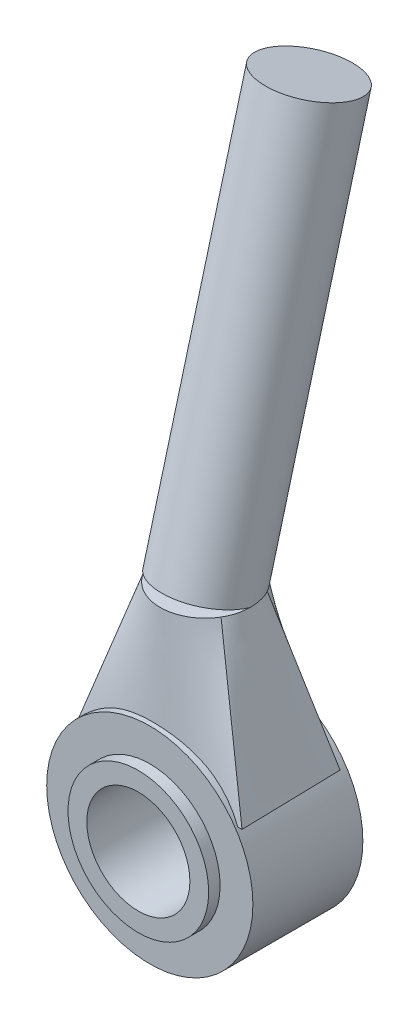
from build123d import *

# Parameters (mm, degrees)
SKETCH1_R               = 18
BOSS_EXTRUDE1_DEPTH     = 19.2
SKETCH2_R               = 12.276458432
SKETCH2_R_2             = 8.347690183
BOSS_EXTRUDE2_DEPTH     = 2
SKETCH3_R               = 8.347690183
BOSS_EXTRUDE4_DEPTH     = 6.8
FILLET1_R               = 4
SKETCH13_R              = 9
CUT_EXTRUDE4_DEPTH      = 50
BOSS_EXTRUDE6_START     = 31.338130328
BOSS_EXTRUDE6_OUTLINE_R = 7.85
BOSS_EXTRUDE6_DEPTH     = 69.999999999


with BuildPart() as part:
    # Sketch1 → Boss-Extrude1 (new body)
    with BuildSketch(Plane.XY):
        Circle(SKETCH1_R)
    extrude(amount=BOSS_EXTRUDE1_DEPTH)

    # Sketch2 → Boss-Extrude2 (add)
    with BuildSketch(Plane.XY.offset(19.2)):
        Circle(SKETCH2_R)
        Circle(SKETCH2_R_2, mode=Mode.SUBTRACT)
    extrude(amount=BOSS_EXTRUDE2_DEPTH)

    # Sketch3 → Boss-Extrude4 (add)
    with BuildSketch(Plane.XY.offset(19.2)):
        Circle(SKETCH3_R)
    extrude(amount=BOSS_EXTRUDE4_DEPTH)

    # Fillet1
    fillet1_edges = [part.edges().sort_by_distance(p)[0] for p in [
        (-8.347690183, 0, 26),
    ]]
    fillet(fillet1_edges, radius=FILLET1_R)

    # Loft5: read off the stored shape, not the designer's step
    # Loft5: loft between two sections, ruled curve by curve
    loft5_from = [
        Edge.make_bspline([(-13.870540046, 10, 1.272084055), (-13.870540046, 10, 2.733260237), (-13.870540046, 10, 4.19443642), (-13.870540046, 10, 7.116788785), (-13.870540046, 10, 8.577964967), (-13.870540046, 10, 11.500317332), (-13.870540046, 10, 12.961493515), (-13.870540046, 10, 15.88384588), (-13.870540046, 10, 17.345022062), (-13.870540046, 10, 18.806198245)], [0, 0, 0, 0, 0.25, 0.25, 0.5, 0.5, 0.75, 0.75, 1, 1, 1, 1], 3),
        Edge.make_bspline([(-13.870540046, 10, 18.806198245), (-12.638187033, 10, 18.806198245), (-11.40583402, 10, 18.806198245), (-8.941127993, 10, 18.806198245), (-7.70877498, 10, 18.806198245), (-5.244068953, 10, 18.806198245), (-4.01171594, 10, 18.806198245), (-1.547009913, 10, 18.806198245), (-0.3146569, 10, 18.806198245), (2.150049127, 10, 18.806198245), (3.38240214, 10, 18.806198245), (5.847108167, 10, 18.806198245), (7.07946118, 10, 18.806198245), (9.544167207, 10, 18.806198245), (10.77652022, 10, 18.806198245), (13.241226247, 10, 18.806198245), (14.47357926, 10, 18.806198245), (15.705932273, 10, 18.806198245)], [0, 0, 0, 0, 0.125, 0.125, 0.25, 0.25, 0.375, 0.375, 0.5, 0.5, 0.625, 0.625, 0.75, 0.75, 0.875, 0.875, 1, 1, 1, 1], 3),
        Edge.make_bspline([(15.293044741, 10, 1.272084055), (14.077895375, 10, 1.272084055), (12.862746008, 10, 1.272084055), (10.432447276, 10, 1.272084055), (9.21729791, 10, 1.272084055), (6.786999178, 10, 1.272084055), (5.571849812, 10, 1.272084055), (3.141551079, 10, 1.272084055), (1.926401713, 10, 1.272084055), (-0.503897019, 10, 1.272084055), (-1.719046385, 10, 1.272084055), (-4.149345117, 10, 1.272084055), (-5.364494484, 10, 1.272084055), (-7.794793216, 10, 1.272084055), (-9.009942582, 10, 1.272084055), (-11.440241314, 10, 1.272084055), (-12.65539068, 10, 1.272084055), (-13.870540046, 10, 1.272084055)], [0, 0, 0, 0, 0.125, 0.125, 0.25, 0.25, 0.375, 0.375, 0.5, 0.5, 0.625, 0.625, 0.75, 0.75, 0.875, 0.875, 1, 1, 1, 1], 3),
        Edge.make_bspline([(15.705932273, 10, 18.806198245), (15.671524979, 10, 17.345022062), (15.637117685, 10, 15.88384588), (15.568303096, 10, 12.961493515), (15.533895801, 10, 11.500317332), (15.465081213, 10, 8.577964967), (15.430673918, 10, 7.116788785), (15.361859329, 10, 4.19443642), (15.327452035, 10, 2.733260237), (15.293044741, 10, 1.272084055)], [0, 0, 0, 0, 0.25, 0.25, 0.5, 0.5, 0.75, 0.75, 1, 1, 1, 1], 3),
    ]
    loft5_to = [
        Edge.make_bspline([(-6.740203008, 35, 5.516591807), (-7.083985671, 35, 6.09243536), (-7.365341755, 35, 6.734156051), (-7.74869442, 35, 8.097700335), (-7.85, 35, 8.818869121), (-7.85, 35, 10.26221196), (-7.74869442, 35, 10.983380746), (-7.365341755, 35, 12.34692503), (-7.083985671, 35, 12.988645721), (-6.740203008, 35, 13.564489274)], [0, 0, 0, 0, 0.25, 0.25, 0.5, 0.5, 0.75, 0.75, 1, 1, 1, 1], 3),
        Edge.make_bspline([(-6.740203008, 35, 13.564489274), (-6.451756257, 35, 14.047643954), (-6.092847535, 35, 14.530224597), (-5.218696772, 35, 15.438416605), (-4.702923047, 35, 15.863536141), (-3.528860323, 35, 16.586454489), (-2.870504053, 35, 16.883315453), (-1.466341415, 35, 17.286893217), (-0.721281456, 35, 17.392785885), (0.769354223, 35, 17.388221597), (1.513751736, 35, 17.277768249), (2.915416578, 35, 16.865599114), (3.57194256, 35, 16.564712015), (4.741556195, 35, 15.834617391), (5.254716863, 35, 15.406347285), (6.123289567, 35, 14.492819102), (6.479236287, 35, 14.00804959), (6.764718843, 35, 13.523137554)], [0, 0, 0, 0, 0.125, 0.125, 0.25, 0.25, 0.375, 0.375, 0.5, 0.5, 0.625, 0.625, 0.75, 0.75, 0.875, 0.875, 1, 1, 1, 1], 3),
        Edge.make_bspline([(6.714912928, 35, 5.474529674), (6.424525906, 35, 4.994962936), (6.064332724, 35, 4.516631942), (5.189797582, 35, 3.61755227), (4.674946594, 35, 3.197289059), (3.505304255, 35, 2.483288448), (2.850457816, 35, 2.190459602), (1.45515568, 35, 1.792552317), (0.715425599, 35, 1.688265686), (-0.76450524, 35, 1.692892109), (-1.503568847, 35, 1.801801607), (-2.896355935, 35, 2.208424757), (-3.549358764, 35, 2.50534208), (-4.714514202, 35, 3.226641519), (-5.226727577, 35, 3.650115443), (-6.095624443, 35, 4.55464527), (-6.452819986, 35, 5.035218898), (-6.740203008, 35, 5.516591807)], [0, 0, 0, 0, 0.125, 0.125, 0.25, 0.25, 0.375, 0.375, 0.5, 0.5, 0.625, 0.625, 0.75, 0.75, 0.875, 0.875, 1, 1, 1, 1], 3),
        Edge.make_bspline([(6.764718843, 35, 13.523137554), (7.105005207, 35, 12.945137428), (7.382450639, 35, 12.301626641), (7.757449733, 35, 10.935584457), (7.854315981, 35, 10.21371246), (7.845383427, 35, 8.770216678), (7.739590849, 35, 8.049598762), (7.347714599, 35, 6.68830211), (7.062326449, 35, 6.048274216), (6.714912928, 35, 5.474529674)], [0, 0, 0, 0, 0.25, 0.25, 0.5, 0.5, 0.75, 0.75, 1, 1, 1, 1], 3),
    ]
    loft5 = Solid(Shell([*[Face.make_surface_from_curves(loft5_from[k], loft5_to[k]) for k in range(4)], Face(Wire(loft5_from)), Face(Wire(loft5_to))]))
    add(loft5)

    # Sketch13 → Cut-Extrude4 (cut)
    with BuildSketch(Plane(origin=(0, 0, 0), x_dir=(-1, 0, 0), z_dir=(0, 0, -1))):
        Circle(SKETCH13_R)
    extrude(amount=-CUT_EXTRUDE4_DEPTH, mode=Mode.SUBTRACT)

    # Boss-Extrude6: read off the stored shape, not the designer's step
    # Boss-Extrude6 outline → Boss-Extrude6 (add)
    with BuildSketch(Plane(origin=(0, 0, 0), x_dir=(1, 0, 0), z_dir=(0, 0.9659258262890691, -0.2588190451025181)).offset(BOSS_EXTRUDE6_START)):
        with Locations((0, -18.274121083)):
            Circle(BOSS_EXTRUDE6_OUTLINE_R)
    extrude(amount=BOSS_EXTRUDE6_DEPTH)


solid = part.part
